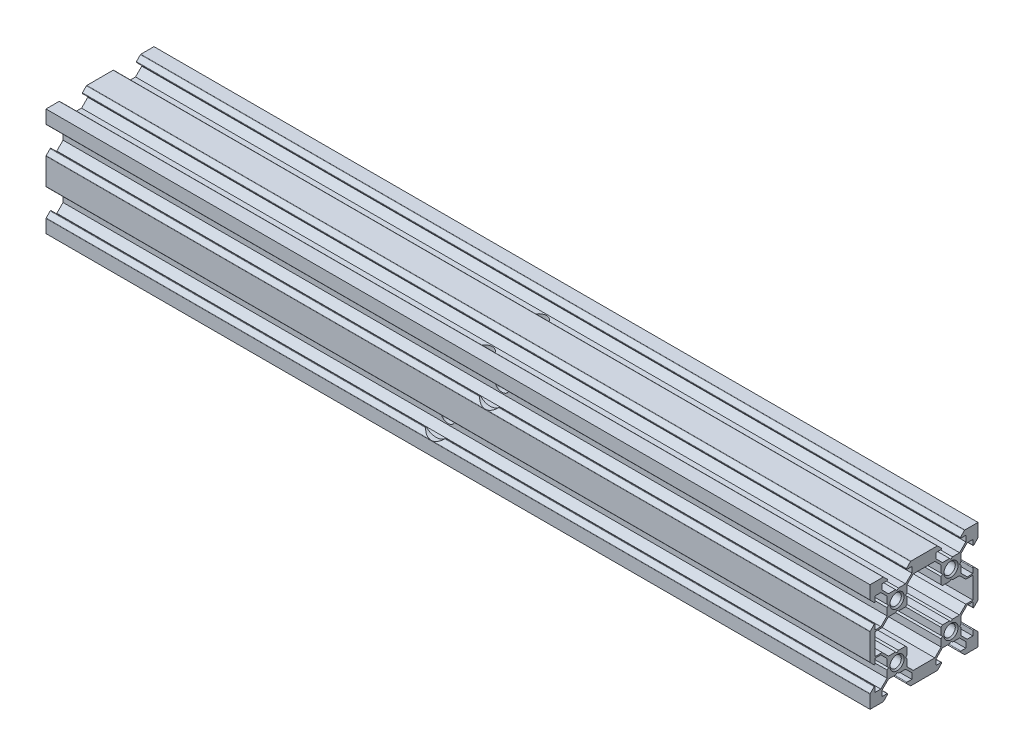
from build123d import *

# Parameters (mm, degrees)
MAIN_BODY_DEPTH           = 145
MAIN_BODY_DEPTH_BACK      = 145
SKETCH2_R                 = 2
CHAMFER1_SIZE             = 0.5
CHAMFER2_SIZE             = 0.5
CHAMFER3_SIZE             = 0.5
SIDE_HOLES_DEPTH          = 151.496569246
SIDE_HOLES_DEPTH_BACK     = 151.496569246
SKETCH3_R                 = 2.6
SIDE_START                = -1.800072
SKETCH4_R                 = 4.75
SIDE_HOLE_CLEARANCE_DEPTH = 1.752766
TOP_HOLES_DEPTH           = 151.496569342
TOP_HOLES_DEPTH_BACK      = 151.496569342
SKETCH5_R                 = 2.6
CUT_EXTRUDE1_REACH        = 154.581
SKETCH6_R                 = 4.75


with BuildPart() as part:
    # Sketch2 → Main Body (new, two sides: drawn at the far end of the back side and taken through both)
    with BuildSketch(Plane(origin=(0, 0, 0), x_dir=(0, 0, -1), z_dir=(1, 0, 0)).offset(-MAIN_BODY_DEPTH_BACK)):
        with BuildLine():
            Line((0.5, 3.5), (0, 3))
            Line((0, 3), (-0.5, 3.5))
            Line((-0.5, 3.5), (-3.01, 3.5))
            Line((-3.01, 3.5), (-5.209102089, 5.699102089))
            Line((-5.209102089, 5.699102089), (-5.209102089, 7.699102089))
            Line((-5.209102089, 7.699102089), (-3.479102089, 7.699102089))
            ThreePointArc((-3.479102089, 7.699102089), (-3.294326183, 7.822565403), (-3.337680733, 8.040523446))
            Line((-3.337680733, 8.040523446), (-4.73775216, 9.440594872))
            ThreePointArc((-4.73775216, 9.440594872), (-4.80263683, 9.483949423), (-4.879173516, 9.499173516))
            Line((-4.879173516, 9.499173516), (-9.499173516, 9.499173516))
            Line((-9.499173516, 9.499173516), (-9.499173516, 4.879173516))
            ThreePointArc((-9.499173516, 4.879173516), (-9.483949423, 4.80263683), (-9.440594872, 4.73775216))
            Line((-9.440594872, 4.73775216), (-8.040523446, 3.337680733))
            ThreePointArc((-8.040523446, 3.337680733), (-7.822565403, 3.294326183), (-7.699102089, 3.479102089))
            Line((-7.699102089, 3.479102089), (-7.699102089, 5.209102089))
            Line((-7.699102089, 5.209102089), (-5.699102089, 5.209102089))
            Line((-5.699102089, 5.209102089), (-3.5, 3.01))
            Line((-3.5, 3.01), (-3.5, 0.5))
            Line((-3.5, 0.5), (-3, 0))
            Line((-3, 0), (-3.5, -0.5))
            Line((-3.5, -0.5), (-3.5, -3.01))
            Line((-3.5, -3.01), (-5.699102089, -5.209102089))
            Line((-5.699102089, -5.209102089), (-7.699102089, -5.209102089))
            Line((-7.699102089, -5.209102089), (-7.699102089, -3.479102089))
            ThreePointArc((-7.699102089, -3.479102089), (-7.822565403, -3.294326183), (-8.040523446, -3.337680733))
            Line((-8.040523446, -3.337680733), (-9.440594872, -4.73775216))
            ThreePointArc((-9.440594872, -4.73775216), (-9.483949423, -4.80263683), (-9.499173516, -4.879173516))
            Line((-9.499173516, -4.879173516), (-9.499173516, -14.119173516))
            ThreePointArc((-9.499173516, -14.119173516), (-9.483949423, -14.195710203), (-9.440594872, -14.260594872))
            Line((-9.440594872, -14.260594872), (-8.040523446, -15.660666299))
            ThreePointArc((-8.040523446, -15.660666299), (-7.822565403, -15.704020849), (-7.699102089, -15.519244943))
            Line((-7.699102089, -15.519244943), (-7.699102089, -13.789244943))
            Line((-7.699102089, -13.789244943), (-5.699102089, -13.789244943))
            Line((-5.699102089, -13.789244943), (-3.5, -15.988347032))
            Line((-3.5, -15.988347032), (-3.5, -18.498347032))
            Line((-3.5, -18.498347032), (-3, -18.998347032))
            Line((-3, -18.998347032), (-3.5, -19.498347032))
            Line((-3.5, -19.498347032), (-3.5, -22.008347032))
            Line((-3.5, -22.008347032), (-5.699102089, -24.207449122))
            Line((-5.699102089, -24.207449122), (-7.699102089, -24.207449122))
            Line((-7.699102089, -24.207449122), (-7.699102089, -22.477449122))
            ThreePointArc((-7.699102089, -22.477449122), (-7.822565403, -22.292673215), (-8.040523446, -22.336027766))
            Line((-8.040523446, -22.336027766), (-9.440594872, -23.736099192))
            ThreePointArc((-9.440594872, -23.736099192), (-9.483949423, -23.800983862), (-9.499173516, -23.877520549))
            Line((-9.499173516, -23.877520549), (-9.499173516, -28.497520549))
            Line((-9.499173516, -28.497520549), (-4.879173516, -28.497520549))
            ThreePointArc((-4.879173516, -28.497520549), (-4.80263683, -28.482296455), (-4.73775216, -28.438941905))
            Line((-4.73775216, -28.438941905), (-3.337680733, -27.038870478))
            ThreePointArc((-3.337680733, -27.038870478), (-3.294326183, -26.820912435), (-3.479102089, -26.697449122))
            Line((-3.479102089, -26.697449122), (-5.209102089, -26.697449122))
            Line((-5.209102089, -26.697449122), (-5.209102089, -24.697449122))
            Line((-5.209102089, -24.697449122), (-3.01, -22.498347032))
            Line((-3.01, -22.498347032), (-0.5, -22.498347032))
            Line((-0.5, -22.498347032), (0, -21.998347032))
            Line((0, -21.998347032), (0.5, -22.498347032))
            Line((0.5, -22.498347032), (3.01, -22.498347032))
            Line((3.01, -22.498347032), (5.209102089, -24.697449122))
            Line((5.209102089, -24.697449122), (5.209102089, -26.697449122))
            Line((5.209102089, -26.697449122), (3.479102089, -26.697449122))
            ThreePointArc((3.479102089, -26.697449122), (3.294326183, -26.820912435), (3.337680733, -27.038870478))
            Line((3.337680733, -27.038870478), (4.73775216, -28.438941905))
            ThreePointArc((4.73775216, -28.438941905), (4.80263683, -28.482296455), (4.879173516, -28.497520549))
            Line((4.879173516, -28.497520549), (14.119173516, -28.497520549))
            ThreePointArc((14.119173516, -28.497520549), (14.195710203, -28.482296455), (14.260594872, -28.438941905))
            Line((14.260594872, -28.438941905), (15.660666299, -27.038870478))
            ThreePointArc((15.660666299, -27.038870478), (15.704020849, -26.820912435), (15.519244943, -26.697449122))
            Line((15.519244943, -26.697449122), (13.789244943, -26.697449122))
            Line((13.789244943, -26.697449122), (13.789244943, -24.697449122))
            Line((13.789244943, -24.697449122), (15.988347032, -22.498347032))
            Line((15.988347032, -22.498347032), (18.498347032, -22.498347032))
            Line((18.498347032, -22.498347032), (18.998347032, -21.998347032))
            Line((18.998347032, -21.998347032), (19.498347032, -22.498347032))
            Line((19.498347032, -22.498347032), (22.008347032, -22.498347032))
            Line((22.008347032, -22.498347032), (24.207449122, -24.697449122))
            Line((24.207449122, -24.697449122), (24.207449122, -26.697449122))
            Line((24.207449122, -26.697449122), (22.477449122, -26.697449122))
            ThreePointArc((22.477449122, -26.697449122), (22.292673215, -26.820912435), (22.336027766, -27.038870478))
            Line((22.336027766, -27.038870478), (23.736099192, -28.438941905))
            ThreePointArc((23.736099192, -28.438941905), (23.800983862, -28.482296455), (23.877520549, -28.497520549))
            Line((23.877520549, -28.497520549), (28.497520549, -28.497520549))
            Line((28.497520549, -28.497520549), (28.497520549, -23.877520549))
            ThreePointArc((28.497520549, -23.877520549), (28.482296455, -23.800983862), (28.438941905, -23.736099192))
            Line((28.438941905, -23.736099192), (27.038870478, -22.336027766))
            ThreePointArc((27.038870478, -22.336027766), (26.820912435, -22.292673215), (26.697449122, -22.477449122))
            Line((26.697449122, -22.477449122), (26.697449122, -24.207449122))
            Line((26.697449122, -24.207449122), (24.697449122, -24.207449122))
            Line((24.697449122, -24.207449122), (22.498347032, -22.008347032))
            Line((22.498347032, -22.008347032), (22.498347032, -19.498347032))
            Line((22.498347032, -19.498347032), (21.998347032, -18.998347032))
            Line((21.998347032, -18.998347032), (22.498347032, -18.498347032))
            Line((22.498347032, -18.498347032), (22.498347032, -15.988347032))
            Line((22.498347032, -15.988347032), (24.697449122, -13.789244943))
            Line((24.697449122, -13.789244943), (26.697449122, -13.789244943))
            Line((26.697449122, -13.789244943), (26.697449122, -15.519244943))
            ThreePointArc((26.697449122, -15.519244943), (26.820912435, -15.704020849), (27.038870478, -15.660666299))
            Line((27.038870478, -15.660666299), (28.438941905, -14.260594872))
            ThreePointArc((28.438941905, -14.260594872), (28.482296455, -14.195710203), (28.497520549, -14.119173516))
            Line((28.497520549, -14.119173516), (28.497520549, -4.879173516))
            ThreePointArc((28.497520549, -4.879173516), (28.482296455, -4.80263683), (28.438941905, -4.73775216))
            Line((28.438941905, -4.73775216), (27.038870478, -3.337680733))
            ThreePointArc((27.038870478, -3.337680733), (26.820912435, -3.294326183), (26.697449122, -3.479102089))
            Line((26.697449122, -3.479102089), (26.697449122, -5.209102089))
            Line((26.697449122, -5.209102089), (24.697449122, -5.209102089))
            Line((24.697449122, -5.209102089), (22.498347032, -3.01))
            Line((22.498347032, -3.01), (22.498347032, -0.5))
            Line((22.498347032, -0.5), (21.998347032, 0))
            Line((21.998347032, 0), (22.498347032, 0.5))
            Line((22.498347032, 0.5), (22.498347032, 3.01))
            Line((22.498347032, 3.01), (24.697449122, 5.209102089))
            Line((24.697449122, 5.209102089), (26.697449122, 5.209102089))
            Line((26.697449122, 5.209102089), (26.697449122, 3.479102089))
            ThreePointArc((26.697449122, 3.479102089), (26.820912435, 3.294326183), (27.038870478, 3.337680733))
            Line((27.038870478, 3.337680733), (28.438941905, 4.73775216))
            ThreePointArc((28.438941905, 4.73775216), (28.482296455, 4.80263683), (28.497520549, 4.879173516))
            Line((28.497520549, 4.879173516), (28.497520549, 9.499173516))
            Line((28.497520549, 9.499173516), (23.877520549, 9.499173516))
            ThreePointArc((23.877520549, 9.499173516), (23.800983862, 9.483949423), (23.736099192, 9.440594872))
            Line((23.736099192, 9.440594872), (22.336027766, 8.040523446))
            ThreePointArc((22.336027766, 8.040523446), (22.292673215, 7.822565403), (22.477449122, 7.699102089))
            Line((22.477449122, 7.699102089), (24.207449122, 7.699102089))
            Line((24.207449122, 7.699102089), (24.207449122, 5.699102089))
            Line((24.207449122, 5.699102089), (22.008347032, 3.5))
            Line((22.008347032, 3.5), (19.498347032, 3.5))
            Line((19.498347032, 3.5), (18.998347032, 3))
            Line((18.998347032, 3), (18.498347032, 3.5))
            Line((18.498347032, 3.5), (15.988347032, 3.5))
            Line((15.988347032, 3.5), (13.789244943, 5.699102089))
            Line((13.789244943, 5.699102089), (13.789244943, 7.699102089))
            Line((13.789244943, 7.699102089), (15.519244943, 7.699102089))
            ThreePointArc((15.519244943, 7.699102089), (15.704020849, 7.822565403), (15.660666299, 8.040523446))
            Line((15.660666299, 8.040523446), (14.260594872, 9.440594872))
            ThreePointArc((14.260594872, 9.440594872), (14.195710203, 9.483949423), (14.119173516, 9.499173516))
            Line((14.119173516, 9.499173516), (4.879173516, 9.499173516))
            ThreePointArc((4.879173516, 9.499173516), (4.80263683, 9.483949423), (4.73775216, 9.440594872))
            Line((4.73775216, 9.440594872), (3.337680733, 8.040523446))
            ThreePointArc((3.337680733, 8.040523446), (3.294326183, 7.822565403), (3.479102089, 7.699102089))
            Line((3.479102089, 7.699102089), (5.209102089, 7.699102089))
            Line((5.209102089, 7.699102089), (5.209102089, 5.699102089))
            Line((5.209102089, 5.699102089), (3.01, 3.5))
            Line((3.01, 3.5), (0.5, 3.5))
        make_face()
        with Locations((0, -18.998347032)):
            Circle(SKETCH2_R, mode=Mode.SUBTRACT)
        with Locations((18.998347032, -18.998347032)):
            Circle(SKETCH2_R, mode=Mode.SUBTRACT)
        Polygon((3.5, -0.5), (3, 0), (3.5, 0.5), (3.5, 3.01), (5.699102089, 5.209102089), (7.699102089, 5.209102089), (11.299244943, 5.209102089), (13.299244943, 5.209102089), (15.498347032, 3.01), (15.498347032, 0.5), (15.998347032, 0), (15.498347032, -0.5), (15.498347032, -3.01), (15.988347032, -3.5), (18.498347032, -3.5), (18.998347032, -3), (19.498347032, -3.5), (22.008347032, -3.5), (24.207449122, -5.699102089), (26.697449122, -5.699102089), (26.697449122, -13.299244943), (24.207449122, -13.299244943), (22.008347032, -15.498347032), (19.498347032, -15.498347032), (18.998347032, -15.998347032), (18.498347032, -15.498347032), (15.988347032, -15.498347032), (15.498347032, -15.988347032), (15.498347032, -18.498347032), (15.998347032, -18.998347032), (15.498347032, -19.498347032), (15.498347032, -22.008347032), (13.299244943, -24.207449122), (11.299244943, -24.207449122), (7.699102089, -24.207449122), (5.699102089, -24.207449122), (3.5, -22.008347032), (3.5, -19.498347032), (3, -18.998347032), (3.5, -18.498347032), (3.5, -15.988347032), (3.01, -15.498347032), (0.5, -15.498347032), (0, -15.998347032), (-0.5, -15.498347032), (-3.01, -15.498347032), (-5.209102089, -13.299244943), (-7.699102089, -13.299244943), (-7.699102089, -5.699102089), (-5.209102089, -5.699102089), (-3.01, -3.5), (-0.5, -3.5), (0, -3), (0.5, -3.5), (3.01, -3.5), (3.5, -3.01), align=None, mode=Mode.SUBTRACT)
        Circle(SKETCH2_R, mode=Mode.SUBTRACT)
        with Locations((18.998347032, 0)):
            Circle(SKETCH2_R, mode=Mode.SUBTRACT)
    extrude(amount=MAIN_BODY_DEPTH + MAIN_BODY_DEPTH_BACK)

    # Chamfer1
    chamfer1_edges = [part.edges().sort_by_distance(p)[0] for p in [
        (145, 0, 2),
    ]]
    chamfer(chamfer1_edges, length=CHAMFER1_SIZE)

    # Chamfer2
    chamfer2_edges = [part.edges().sort_by_distance(p)[0] for p in [
        (-145, 0, 2),
    ]]
    chamfer(chamfer2_edges, length=CHAMFER2_SIZE)

    # Chamfer3
    chamfer3_edges = [part.edges().sort_by_distance(p)[0] for p in [
        (145, -18.998347032, -16.998347032),
        (145, -18.998347032, 2),
        (145, 0, -16.998347032),
        (-145, -18.998347032, -16.998347032),
        (-145, -18.998347032, 2),
        (-145, 0, -16.998347032),
    ]]
    chamfer(chamfer3_edges, length=CHAMFER3_SIZE)

    # Sketch3 → Side Holes (cut, two sides: drawn at the far end of the back side and taken through both)
    with BuildSketch(Plane.XY.offset(-SIDE_HOLES_DEPTH_BACK)):
        with Locations((9.5, 0)):
            Circle(SKETCH3_R)
        with Locations((-9.5, -18.998347032)):
            Circle(SKETCH3_R)
    extrude(amount=SIDE_HOLES_DEPTH + SIDE_HOLES_DEPTH_BACK, mode=Mode.SUBTRACT)

    # Sketch4 → Side Hole Clearance (cut)
    with BuildSketch(Plane.XY.offset(9.499173516).offset(SIDE_START)):
        with Locations((9.5, 0)):
            Circle(SKETCH4_R)
        with Locations((-9.5, -18.998347032)):
            Circle(SKETCH4_R)
    extrude(amount=SIDE_HOLE_CLEARANCE_DEPTH, mode=Mode.SUBTRACT)

    # Sketch5 → Top Holes (cut, two sides: drawn at the far end of the back side and taken through both)
    with BuildSketch(Plane(origin=(0, 0, 0), x_dir=(1, 0, 0), z_dir=(0, 1, 0)).offset(-TOP_HOLES_DEPTH_BACK)):
        with Locations(Location((0, 18.998347032, 0), (0, 0, 348.912510789))):
            Circle(SKETCH5_R)
        with Locations(Location((0, 0, 0), (0, 0, 348.912510789))):
            Circle(SKETCH5_R)
    extrude(amount=TOP_HOLES_DEPTH + TOP_HOLES_DEPTH_BACK, mode=Mode.SUBTRACT)

    # Cut-Extrude1: up to this face of the body (flat: up to its plane)
    cut_extrude1_end = Plane(part.part.faces().sort_by_distance((0, -26.697449122, -14.654244943))[0])
    # Sketch6 → Cut-Extrude1 (cut, up to the picked face)
    with BuildSketch(Plane.XZ.offset(28.497520549), mode=Mode.PRIVATE) as cut_extrude1_sk1:
        Circle(SKETCH6_R)
    cut_extrude1_tool1 = split(extrude(cut_extrude1_sk1.sketch, amount=-CUT_EXTRUDE1_REACH, mode=Mode.PRIVATE), bisect_by=cut_extrude1_end, keep=Keep.BOTH, mode=Mode.PRIVATE)
    # Sketch6 → Cut-Extrude1 (cut, up to the picked face)
    with BuildSketch(Plane.XZ.offset(28.497520549), mode=Mode.PRIVATE) as cut_extrude1_sk2:
        with Locations((0, -18.998347032)):
            Circle(SKETCH6_R)
    cut_extrude1_tool2 = split(extrude(cut_extrude1_sk2.sketch, amount=-CUT_EXTRUDE1_REACH, mode=Mode.PRIVATE), bisect_by=cut_extrude1_end, keep=Keep.BOTH, mode=Mode.PRIVATE)
    add(cut_extrude1_tool1.solids().sort_by(Axis((0, -28.497521, 0), (0, 1, 0)))[0], mode=Mode.SUBTRACT)
    add(cut_extrude1_tool2.solids().sort_by(Axis((0, -28.497521, -18.998347), (0, 1, 0)))[0], mode=Mode.SUBTRACT)


solid = part.part
